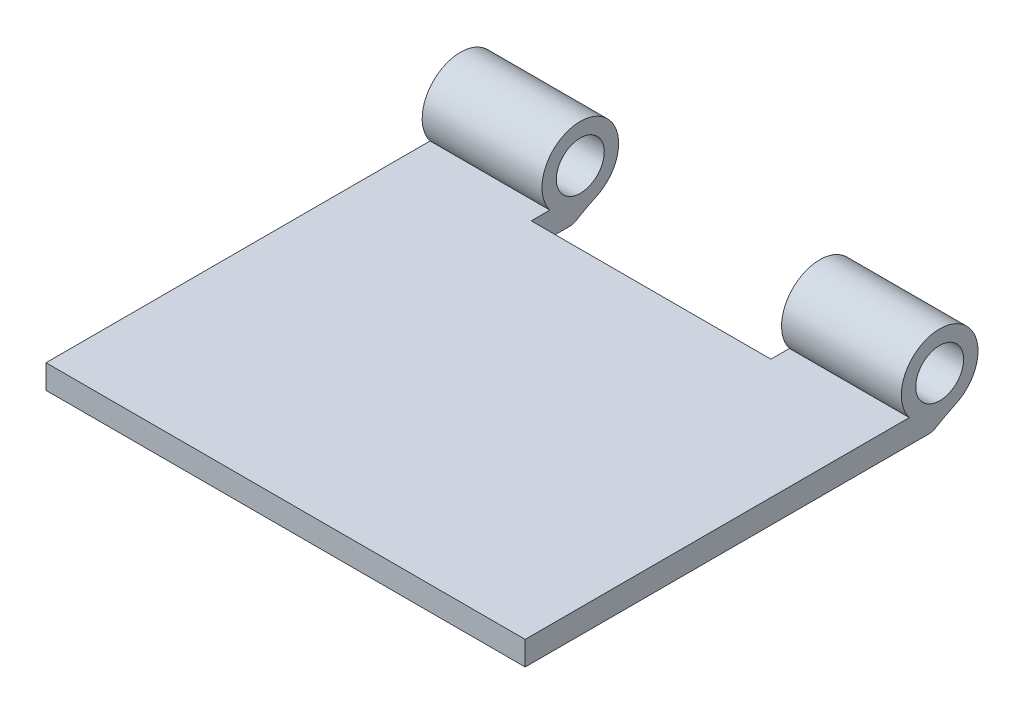
from build123d import *

# Parameters (mm, degrees)
SKETCH1_W           = 20
SKETCH1_H           = 17
BOSS_EXTRUDE1_DEPTH = 1
SKETCH2_R           = 1.6
SKETCH2_R_2         = 1
BOSS_EXTRUDE2_DEPTH = 20
FILLET1_R           = 10
FILLET2_R           = 0.5
SKETCH4_W           = 10
SKETCH4_H           = 10.104734337
CUT_EXTRUDE3_DEPTH  = 15.86420015


with BuildPart() as part:
    # Sketch1 → Boss-Extrude1 (new body)
    with BuildSketch(Plane(origin=(0, 0, 0), x_dir=(1, 0, 0), z_dir=(0, 1, 0))):
        Rectangle(SKETCH1_W, SKETCH1_H)
    extrude(amount=BOSS_EXTRUDE1_DEPTH)

    # Sketch2 → Boss-Extrude2 (add)
    with BuildSketch(Plane(origin=(10, 0, 0), x_dir=(0, 0, -1), z_dir=(1, 0, 0))):
        with Locations((8.800384095, 1.974416987)):
            Circle(SKETCH2_R)
        with Locations((8.800384095, 1.974416987)):
            Circle(SKETCH2_R_2, mode=Mode.SUBTRACT)
    extrude(amount=-BOSS_EXTRUDE2_DEPTH)

    # Fillet1
    # the kernel refuses this fillet: 10 mm, written as the material it adds along each edge
    with BuildSketch(Plane(origin=(-10, 0.402866989, -8.5), x_dir=(0, -1, 0), z_dir=(1, 0, 0))) as fillet1_piece_1:
        with BuildLine():
            CenterArc((8.937605274, 5.21135706), FILLET1_R, 205.046884286, 6.361578996)
            Line((-0.12201134, 0.977759676), (-0.303203672, 0.893087728))
            ThreePointArc((-0.303203672, 0.893087728), (-0.18232452, 0.473740867), (-0.19644375, 0.037548012))
            Line((-0.19644375, 0.037548012), (0, -0.2))
            ThreePointArc((0, -0.2), (0.201433495, -0.2), (0.232172223, -0.104227141))
            Line((0.232172223, -0.104227141), (0.402866989, 0))
        make_face()
    extrude(amount=20)

    # Fillet2
    fillet2_edges = [part.edges().sort_by_distance(p)[0] for p in [
        (0, 0, -8.5),
    ]]
    fillet(fillet2_edges, radius=FILLET2_R)

    # Sketch4 → Cut-Extrude3 (cut, through all)
    with BuildSketch(Plane(origin=(0, 0, 0), x_dir=(1, 0, 0), z_dir=(0, 1, 0))):
        with Locations((0, 11.80749184)):
            Rectangle(SKETCH4_W, SKETCH4_H)
    extrude(amount=CUT_EXTRUDE3_DEPTH, mode=Mode.SUBTRACT)


solid = part.part
